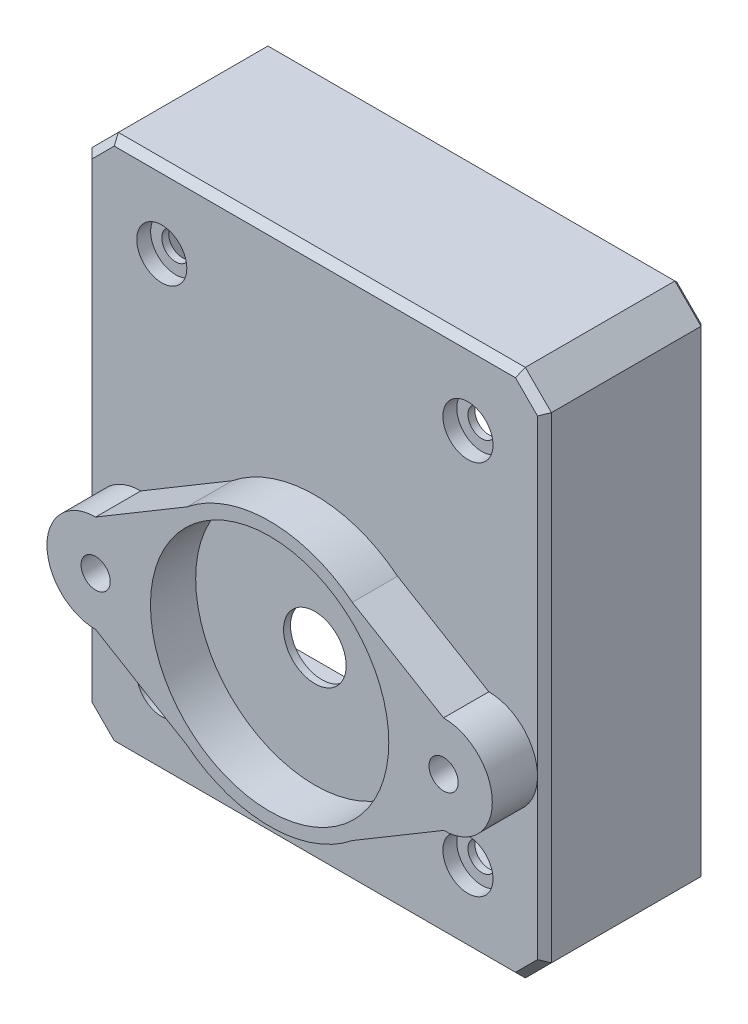
from build123d import *

# Parameters (mm, degrees)
SKIZZE1_W                       = 60
SKIZZE1_H                       = 70
GRUNDK_RPER_DEPTH               = 20
FASE1_SIZE                      = 2
WANDUNG1_T                      = 3
SKIZZE2_R                       = 4.5
DURCHBRUCH_SERVO_DEPTH          = 100.13122616
SKIZZE4_W                       = 22
SKIZZE4_H                       = 42
SERVOFREISCHNITT_DEPTH          = 2
SKIZZE3_R                       = 2.1
FLANSCHAUFSATZ_DEPTH            = 6.5
SKIZZE6_R                       = 17.125
BOHRUNGSCHNECKE_DEPTH           = 6.5
SCHNITT_LINEAR_AUSTRAGEN2_REACH = 101.131
SKIZZE7_R                       = 2
SKIZZE8_R                       = 3.6
SCHNITT_LINEAR_AUSTRAGEN3_DEPTH = 2
FASE2_SIZE                      = 1
FASE3_SIZE                      = 0.5


with BuildPart() as part:
    # Skizze1 → Grundkörper (new body)
    with BuildSketch(Plane.XY):
        with Locations((30, 35)):
            Rectangle(SKIZZE1_W, SKIZZE1_H)
    extrude(amount=GRUNDK_RPER_DEPTH)

    # Fase1
    fase1_edges = [part.edges().sort_by_distance(p)[0] for p in [
        (0, 70, 10),
        (60, 70, 10),
        (60, 0, 10),
        (0, 0, 10),
    ]]
    chamfer(fase1_edges, length=FASE1_SIZE)

    # Wandung1
    wandung1_openings = [part.faces().sort_by_distance(p)[0] for p in [
        (30, 35, 0),
    ]]
    offset(amount=WANDUNG1_T, openings=wandung1_openings, kind=Kind.INTERSECTION)

    # Skizze2 → Durchbruch Servo (cut, through all)
    with BuildSketch(Plane.XY.offset(23)):
        with Locations((30, 24)):
            Circle(SKIZZE2_R)
    extrude(amount=-DURCHBRUCH_SERVO_DEPTH, mode=Mode.SUBTRACT)

    # Skizze4 → ServoFreischnitt (cut)
    with BuildSketch(Plane(origin=(0, 0, 20), x_dir=(-1, 0, 0), z_dir=(0, 0, -1))):
        with Locations((-30, 35)):
            Rectangle(SKIZZE4_W, SKIZZE4_H)
    extrude(amount=-SERVOFREISCHNITT_DEPTH, mode=Mode.SUBTRACT)

    # Skizze3 → FlanschAufsatz (add)
    with BuildSketch(Plane.XY.offset(23)):
        with BuildLine():
            Line((5, 31), (18.11121742, 38.820824834))
            ThreePointArc((18.11121742, 38.820824834), (30, 43), (41.88878258, 38.820824834))
            Line((41.88878258, 38.820824834), (55, 31))
            ThreePointArc((55, 31), (62, 24), (55, 17))
            Line((55, 17), (41.88878258, 9.179175166))
            ThreePointArc((41.88878258, 9.179175166), (30, 5), (18.11121742, 9.179175166))
            Line((18.11121742, 9.179175166), (5, 17))
            ThreePointArc((5, 17), (-2, 24), (5, 31))
        make_face()
        with Locations(Location((5, 24, 0), (0, 0, 180))):
            Circle(SKIZZE3_R, mode=Mode.SUBTRACT)
        with Locations(Location((55, 24, 0), (0, 0, 180))):
            Circle(SKIZZE3_R, mode=Mode.SUBTRACT)
    extrude(amount=FLANSCHAUFSATZ_DEPTH)

    # Skizze6 → BohrungSchnecke (cut)
    with BuildSketch(Plane.XY.offset(29.5)):
        with Locations((30, 24)):
            Circle(SKIZZE6_R)
    extrude(amount=-BOHRUNGSCHNECKE_DEPTH, mode=Mode.SUBTRACT)

    # Skizze7 → Schnitt-Linear austragen2 (cut, up to next)
    with BuildSketch(Plane.XY.offset(23), mode=Mode.PRIVATE) as schnitt_linear_austragen2_sk1:
        with Locations((8, 62)):
            Circle(SKIZZE7_R)
    schnitt_linear_austragen2_tool1 = extrude(schnitt_linear_austragen2_sk1.sketch, amount=-SCHNITT_LINEAR_AUSTRAGEN2_REACH, mode=Mode.PRIVATE) & part.part
    # Skizze7 → Schnitt-Linear austragen2 (cut, up to next)
    with BuildSketch(Plane.XY.offset(23), mode=Mode.PRIVATE) as schnitt_linear_austragen2_sk2:
        with Locations(Location((52, 62, 0), (0, 0, 180))):
            Circle(SKIZZE7_R)
    schnitt_linear_austragen2_tool2 = extrude(schnitt_linear_austragen2_sk2.sketch, amount=-SCHNITT_LINEAR_AUSTRAGEN2_REACH, mode=Mode.PRIVATE) & part.part
    # Skizze7 → Schnitt-Linear austragen2 (cut, up to next)
    with BuildSketch(Plane.XY.offset(23), mode=Mode.PRIVATE) as schnitt_linear_austragen2_sk3:
        with Locations((52, 8)):
            Circle(SKIZZE7_R)
    schnitt_linear_austragen2_tool3 = extrude(schnitt_linear_austragen2_sk3.sketch, amount=-SCHNITT_LINEAR_AUSTRAGEN2_REACH, mode=Mode.PRIVATE) & part.part
    # Skizze7 → Schnitt-Linear austragen2 (cut, up to next)
    with BuildSketch(Plane.XY.offset(23), mode=Mode.PRIVATE) as schnitt_linear_austragen2_sk4:
        with Locations(Location((8, 8, 0), (0, 0, 180))):
            Circle(SKIZZE7_R)
    schnitt_linear_austragen2_tool4 = extrude(schnitt_linear_austragen2_sk4.sketch, amount=-SCHNITT_LINEAR_AUSTRAGEN2_REACH, mode=Mode.PRIVATE) & part.part
    add(schnitt_linear_austragen2_tool1.solids().sort_by_distance((8, 62, 23))[0], mode=Mode.SUBTRACT)
    add(schnitt_linear_austragen2_tool2.solids().sort_by_distance((52, 62, 23))[0], mode=Mode.SUBTRACT)
    add(schnitt_linear_austragen2_tool3.solids().sort_by_distance((52, 8, 23))[0], mode=Mode.SUBTRACT)
    add(schnitt_linear_austragen2_tool4.solids().sort_by_distance((8, 8, 23))[0], mode=Mode.SUBTRACT)

    # Skizze8 → Schnitt-Linear austragen3 (cut)
    with BuildSketch(Plane.XY.offset(23)):
        with Locations((8, 62)):
            Circle(SKIZZE8_R)
        with Locations((52, 62)):
            Circle(SKIZZE8_R)
        with Locations((52, 8)):
            Circle(SKIZZE8_R)
        with Locations((8, 8)):
            Circle(SKIZZE8_R)
    extrude(amount=-SCHNITT_LINEAR_AUSTRAGEN3_DEPTH, mode=Mode.SUBTRACT)

    # Fase2
    fase2_edges = [part.edges().sort_by_distance(p)[0] for p in [
        (63, 35, 23),
        (30, -3, 23),
        (-3, 35, 23),
        (30, 73, 23),
        (61.121320344, 71.121320344, 23),
        (-1.121320344, 71.121320344, 23),
        (-1.121320344, -1.121320344, 23),
        (61.121320344, -1.121320344, 23),
    ]]
    chamfer(fase2_edges, length=FASE2_SIZE - 0.0001)  # a hair under: the kernel refuses the full size

    # Fase3
    fase3_edges = [part.edges().sort_by_distance(p)[0] for p in [
        (63, 35, 0),
        (-3, 35, 0),
        (30, 73, 0),
        (30, -3, 0),
        (61.121320344, 71.121320344, 0),
        (-1.121320344, 71.121320344, 0),
        (-1.121320344, -1.121320344, 0),
        (61.121320344, -1.121320344, 0),
        (0, 35, 0),
        (30, 0, 0),
        (60, 35, 0),
        (30, 70, 0),
        (59, 1, 0),
        (1, 1, 0),
        (1, 69, 0),
        (59, 69, 0),
    ]]
    chamfer(fase3_edges, length=FASE3_SIZE)


solid = part.part
